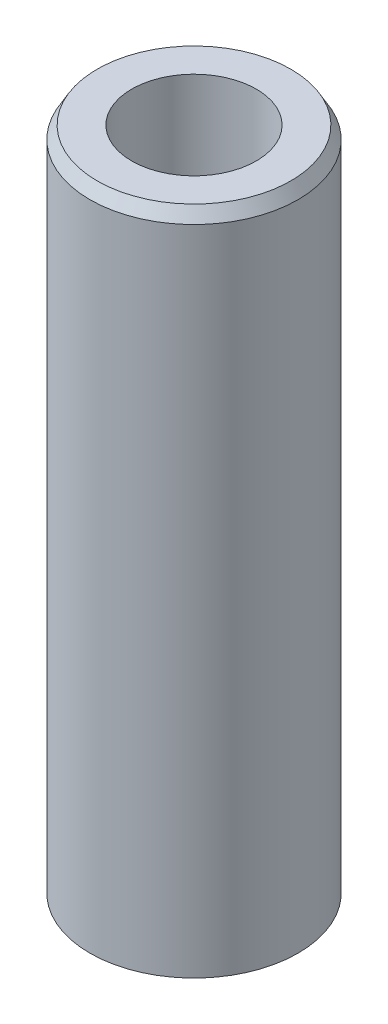
from build123d import *
from OCP.BRepFilletAPI import BRepFilletAPI_MakeChamfer

# Parameters (mm, degrees)
SKETCH1_R           = 10
BOSS_EXTRUDE1_DEPTH = 64.600732355
SKETCH2_R           = 5.985075963
CUT_EXTRUDE1_DEPTH  = 67.130587634
CHAMFER1_SIZE       = 1.210295518
CHAMFER1_SIZE2      = 0.698764443


with BuildPart() as part:
    # Sketch1 → Boss-Extrude1 (new body)
    with BuildSketch(Plane(origin=(0, 0, 0), x_dir=(1, 0, 0), z_dir=(0, 1, 0))):
        Circle(SKETCH1_R)
    extrude(amount=BOSS_EXTRUDE1_DEPTH)

    # Sketch2 → Cut-Extrude1 (cut, through all)
    with BuildSketch(Plane(origin=(0, 0, 0), x_dir=(1, 0, 0), z_dir=(0, 1, 0))):
        Circle(SKETCH2_R)
    extrude(amount=CUT_EXTRUDE1_DEPTH, mode=Mode.SUBTRACT)

    # Chamfer1: one chamfer whose edges measure the first distance from different faces: ONE call of the kernel's chamfer builder (chamfer() names one face for all edges)
    chamfer1_edges_1 = [part.edges().sort_by_distance(p)[0] for p in [
        (-10, 64.600732355, 0),
    ]]
    chamfer1_side_1 = [part.faces().sort_by_distance(p)[0] for p in [
        (-10, 32.300366177, 0),
    ]]
    chamfer1_edges_2 = [part.edges().sort_by_distance(p)[0] for p in [
        (-10, 0, 0),
    ]]
    chamfer1_side_2 = [part.faces().sort_by_distance(p)[0] for p in [
        (-9.717157288, 0, 0),
    ]]
    chamfer1 = BRepFilletAPI_MakeChamfer(part.part.solid().wrapped)
    for e in chamfer1_edges_1:
        chamfer1.Add(CHAMFER1_SIZE, CHAMFER1_SIZE2, e.wrapped, chamfer1_side_1[0].wrapped)  # the first distance lies on this face
    for e in chamfer1_edges_2:
        chamfer1.Add(CHAMFER1_SIZE, CHAMFER1_SIZE2, e.wrapped, chamfer1_side_2[0].wrapped)  # the first distance lies on this face
    add(Compound.cast(chamfer1.Shape()), mode=Mode.REPLACE)


solid = part.part
